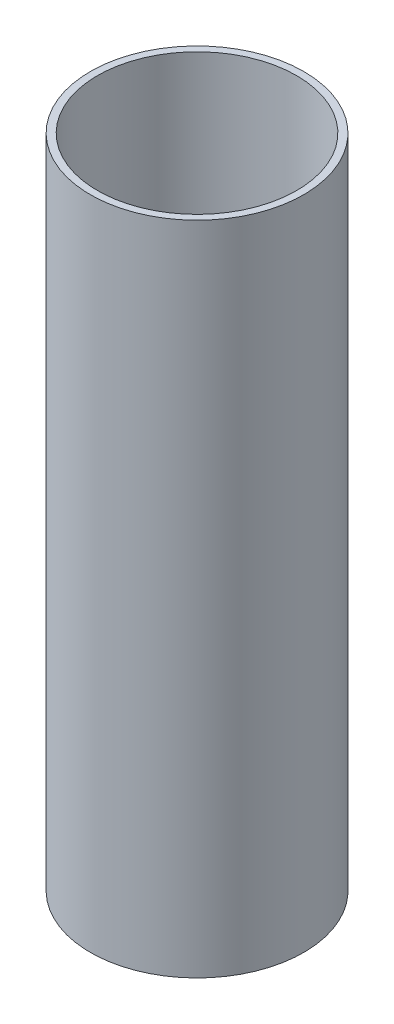
from build123d import *

# Parameters (mm, degrees)
SKETCH1_W = 1.9304
SKETCH1_H = 177.8


with BuildPart() as part:
    # Sketch1 → Revolve1 (revolve)
    with BuildSketch(Plane.XY):
        with Locations((27.9527, -107.179790332)):
            Rectangle(SKETCH1_W, SKETCH1_H)
    revolve(axis=Axis((0, 0, 0), (0, 1, 0)))


solid = part.part
